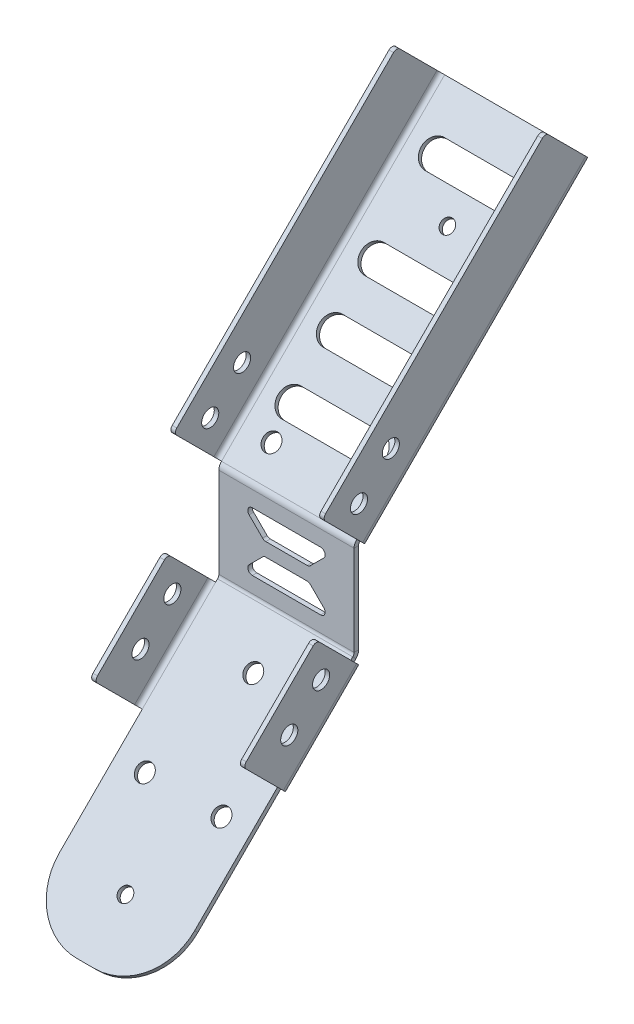
from build123d import *

# Parameters (mm, degrees)
BASE_FLANGE1_DEPTH     = 1
SKETCHED_START         = -30
SKETCHED_BEND5_DEPTH   = 60
SKETCHED_BEND5_2_DEPTH = 15
SKETCHED_START_2       = 15
SKETCHED_BEND5_3_DEPTH = 15
SKETCHED_BEND5_4_DEPTH = 60
SKETCHED_START_3       = -15
SKETCHED_BEND5_5_DEPTH = 30
SKETCHED_BEND6_DEPTH   = 60
SKETCHED_BEND6_2_DEPTH = 15
SKETCHED_BEND6_3_DEPTH = 15
SKETCHED_BEND6_4_DEPTH = 30
SKETCHED_BEND6_5_DEPTH = 60
SKETCHED_START_4       = -28.356310605
SKETCHED_BEND7_DEPTH   = 23
SKETCHED_BEND7_2_DEPTH = 23
SKETCHED_START_5       = 11.547743288
SKETCHED_BEND8_DEPTH   = 70
SKETCHED_BEND8_2_DEPTH = 70
CUT_EXTRUDE1_DEPTH     = 10
F_6_CLEARANCE_HOLE4_D  = 3.7973
F_6_CLEARANCE_HOLE2_D  = 3.7973
F_3_0MM_DOWEL_HOLE1_D  = 3
SKETCH47_R             = 1.525
CUT_EXTRUDE2_DEPTH     = 10
CUT_EXTRUDE3_DEPTH     = 10
FILLET2_R              = 13
FILLET1_R              = 1


# Read off the part's stored shape, not the designer's step: Sketched Bend5, Sketched Bend6, Sketched Bend7, Sketched Bend8
# Sheet-metal steps are written as plain solids
with BuildPart() as part:
    # Sketch1 → Base-Flange1 (new body)
    with BuildSketch(Plane.XY):
        Polygon((-30, -30.5), (-15, -30.5), (-15, -69.5), (15, -69.5), (15, -30.5), (30, -30.5), (30, -7.5), (15, -7.5), (15, 15.5), (30, 15.5), (30, 85.5), (-30, 85.5), (-30, 15.5), (-15, 15.5), (-15, -7.5), (-30, -7.5), align=None)
    extrude(amount=-BASE_FLANGE1_DEPTH)

    # Sketched Bend5 outline → Sketched Bend5 (cut)
    with BuildSketch(Plane.YZ.offset(SKETCHED_START)):
        with BuildLine():
            Line((15.714213562, -0.585786438), (16.128427124, -1))
            Line((16.128427124, -1), (85.5, -1))
            Line((85.5, -1), (85.5, 0))
            Line((85.5, 0), (14.3, 0))
            ThreePointArc((14.3, 0), (15.065366865, -0.152240935), (15.714213562, -0.585786438))
        make_face()
    extrude(amount=SKETCHED_BEND5_DEPTH, mode=Mode.SUBTRACT)

    # Sketched Bend5 2 outline → Sketched Bend5 2 (cut)
    with BuildSketch(Plane.YZ.offset(SKETCHED_START)):
        with BuildLine():
            Line((15.729701149, -0.601274024), (15.714213562, -0.585786438))
            ThreePointArc((15.714213562, -0.585786438), (15.610403483, -0.48909209), (15.5, -0.4))
            Line((15.5, -0.4), (15.5, -0.830975173))
            Line((15.5, -0.830975173), (15.729701149, -0.601274024))
        make_face()
    extrude(amount=SKETCHED_BEND5_2_DEPTH, mode=Mode.SUBTRACT)

    # Sketched Bend5 3 outline → Sketched Bend5 3 (cut)
    with BuildSketch(Plane.YZ.offset(SKETCHED_START_2)):
        with BuildLine():
            Line((15.729701149, -0.601274024), (15.714213562, -0.585786438))
            ThreePointArc((15.714213562, -0.585786438), (15.610403483, -0.48909209), (15.5, -0.4))
            Line((15.5, -0.4), (15.5, -0.830975173))
            Line((15.5, -0.830975173), (15.729701149, -0.601274024))
        make_face()
    extrude(amount=SKETCHED_BEND5_3_DEPTH, mode=Mode.SUBTRACT)

    # Sketched Bend5 4 outline → Sketched Bend5 4 (add)
    with BuildSketch(Plane.YZ.offset(SKETCHED_START)):
        Polygon((65.227175832, -50.098748707), (16.128427124, -1), (15.5, -1), (15.5, -0.830975173), (15.022594368, -1.308380805), (64.520069051, -50.805855488), align=None)
    extrude(amount=SKETCHED_BEND5_4_DEPTH)

    # Sketched Bend5 5 outline → Sketched Bend5 5 (add)
    with BuildSketch(Plane.YZ.offset(SKETCHED_START_3)):
        with BuildLine():
            Line((15.022594368, -1.308380805), (15.330975173, -1))
            Line((15.330975173, -1), (14.3, -1))
            ThreePointArc((14.3, -1), (14.682683432, -1.076120467), (15.007106781, -1.292893219))
            Line((15.007106781, -1.292893219), (15.022594368, -1.308380805))
        make_face()
    extrude(amount=SKETCHED_BEND5_5_DEPTH)

    # Sketched Bend6 outline → Sketched Bend6 (cut)
    with BuildSketch(Plane.YZ.offset(SKETCHED_START)):
        with BuildLine():
            ThreePointArc((-5.710951377, -1), (-6.476318242, -0.847759065), (-7.12516494, -0.414213562))
            Line((-7.12516494, -0.414213562), (-7.539378502, 0))
            Line((-7.539378502, 0), (-69.5, 0))
            Line((-69.5, 0), (-69.5, -1))
            Line((-69.5, -1), (-5.710951377, -1))
        make_face()
    extrude(amount=SKETCHED_BEND6_DEPTH, mode=Mode.SUBTRACT)

    # Sketched Bend6 2 outline → Sketched Bend6 2 (cut)
    with BuildSketch(Plane.YZ.offset(SKETCHED_START)):
        Polygon((-7.539378502, 0), (-7.5, -0.039378502), (-7.5, 0), align=None)
    extrude(amount=SKETCHED_BEND6_2_DEPTH, mode=Mode.SUBTRACT)

    # Sketched Bend6 3 outline → Sketched Bend6 3 (cut)
    with BuildSketch(Plane.YZ.offset(SKETCHED_START_2)):
        Polygon((-7.539378502, 0), (-7.5, -0.039378502), (-7.5, 0), align=None)
    extrude(amount=SKETCHED_BEND6_3_DEPTH, mode=Mode.SUBTRACT)

    # Sketched Bend6 4 outline → Sketched Bend6 4 (add)
    with BuildSketch(Plane.YZ.offset(SKETCHED_START_3)):
        with BuildLine():
            Line((-7.539378502, 0), (-5.710951377, 0))
            ThreePointArc((-5.710951377, 0), (-6.09363481, 0.076120467), (-6.418058159, 0.292893219))
            Line((-6.418058159, 0.292893219), (-50.690686454, 44.565521514))
            Line((-50.690686454, 44.565521514), (-51.397793235, 43.858414733))
            Line((-51.397793235, 43.858414733), (-7.539378502, 0))
        make_face()
    extrude(amount=SKETCHED_BEND6_4_DEPTH)

    # Sketched Bend6 5 outline → Sketched Bend6 5 (add)
    with BuildSketch(Plane.YZ.offset(SKETCHED_START)):
        Polygon((-23.820628769, 16.281250267), (-7.557172802, 0.0177943), (-6.850066021, 0.724901081), (-23.113521988, 16.988357048), align=None)
    extrude(amount=SKETCHED_BEND6_5_DEPTH)

    # Sketched Bend7 outline → Sketched Bend7 (cut)
    with BuildSketch(Plane(origin=(0, 0, 0), x_dir=(1, 0, 0), z_dir=(0, 0.707106781186546, -0.707106781186549)).offset(SKETCHED_START_4)):
        with BuildLine():
            ThreePointArc((-16.732050807, 4.331145665), (-16, 5.063196472), (-15, 5.331145665))
            Line((-15, 5.331145665), (-30, 5.331145665))
            Line((-30, 5.331145665), (-30, 4.331145665))
            Line((-30, 4.331145665), (-16.732050807, 4.331145665))
        make_face()
        with BuildLine():
            Line((30, 5.331145665), (15, 5.331145665))
            ThreePointArc((15, 5.331145665), (16, 5.063196472), (16.732050807, 4.331145665))
            Line((16.732050807, 4.331145665), (30, 4.331145665))
            Line((30, 4.331145665), (30, 5.331145665))
        make_face()
    extrude(amount=SKETCHED_BEND7_DEPTH, mode=Mode.SUBTRACT)

    # Sketched Bend7 2 outline → Sketched Bend7 2 (add)
    with BuildSketch(Plane(origin=(0, 0, 0), x_dir=(1, 0, 0), z_dir=(0, 0.707106781186546, -0.707106781186549)).offset(SKETCHED_START_4)):
        with BuildLine():
            Line((-15, 4.331145665), (-16.732050807, 4.331145665))
            ThreePointArc((-16.732050807, 4.331145665), (-16.931851652, 3.848783755), (-17, 3.331145665))
            Line((-17, 3.331145665), (-17, -9.312659845))
            Line((-17, -9.312659845), (-16, -9.312659845))
            Line((-16, -9.312659845), (-16, 3.331145665))
            ThreePointArc((-16, 3.331145665), (-15.707106781, 4.038252446), (-15, 4.331145665))
        make_face()
        with BuildLine():
            ThreePointArc((17, 3.331145665), (16.931851652, 3.848783755), (16.732050807, 4.331145665))
            Line((16.732050807, 4.331145665), (15, 4.331145665))
            ThreePointArc((15, 4.331145665), (15.707106781, 4.038252446), (16, 3.331145665))
            Line((16, 3.331145665), (16, -9.312659845))
            Line((16, -9.312659845), (17, -9.312659845))
            Line((17, -9.312659845), (17, 3.331145665))
        make_face()
    extrude(amount=SKETCHED_BEND7_2_DEPTH)

    # Sketched Bend8 outline → Sketched Bend8 (cut)
    with BuildSketch(Plane(origin=(0, 0, 0), x_dir=(1, 0, 0), z_dir=(0, 0.707106781186546, -0.707106781186549)).offset(SKETCHED_START_5)):
        with BuildLine():
            Line((-30, -10.697413409), (-16.732050808, -10.697413409))
            ThreePointArc((-16.732050808, -10.697413409), (-16, -9.965362601), (-15, -9.697413409))
            Line((-15, -9.697413409), (-30, -9.697413409))
            Line((-30, -9.697413409), (-30, -10.697413409))
        make_face()
        with BuildLine():
            Line((30, -9.697413409), (15, -9.697413409))
            ThreePointArc((15, -9.697413409), (16, -9.965362601), (16.732050808, -10.697413409))
            Line((16.732050808, -10.697413409), (30, -10.697413409))
            Line((30, -10.697413409), (30, -9.697413409))
        make_face()
    extrude(amount=SKETCHED_BEND8_DEPTH, mode=Mode.SUBTRACT)

    # Sketched Bend8 2 outline → Sketched Bend8 2 (add)
    with BuildSketch(Plane(origin=(0, 0, 0), x_dir=(1, 0, 0), z_dir=(0, 0.707106781186546, -0.707106781186549)).offset(SKETCHED_START_5)):
        with BuildLine():
            ThreePointArc((-16.732050808, -10.697413409), (-16.931851653, -11.179775319), (-17, -11.697413409))
            Line((-17, -11.697413409), (-17, -24.341218918))
            Line((-17, -24.341218918), (-16, -24.341218918))
            Line((-16, -24.341218918), (-16, -11.697413409))
            ThreePointArc((-16, -11.697413409), (-15.707106781, -10.990306628), (-15, -10.697413409))
            Line((-15, -10.697413409), (-16.732050808, -10.697413409))
        make_face()
        with BuildLine():
            Line((16.732050808, -10.697413409), (15, -10.697413409))
            ThreePointArc((15, -10.697413409), (15.707106781, -10.990306628), (16, -11.697413409))
            Line((16, -11.697413409), (16, -24.341218918))
            Line((16, -24.341218918), (17, -24.341218918))
            Line((17, -24.341218918), (17, -11.697413409))
            ThreePointArc((17, -11.697413409), (16.931851653, -11.179775319), (16.732050808, -10.697413409))
        make_face()
    extrude(amount=SKETCHED_BEND8_2_DEPTH)

    # Sketch36 → Cut-Extrude1 (cut)
    with BuildSketch(Plane(origin=(0, 7.564213562, 7.564213562), x_dir=(1, 0, 0), z_dir=(0, 0.7071067811865487, 0.7071067811865465))):
        with BuildLine():
            Line((-9, 28), (9, 28))
            ThreePointArc((9, 28), (12, 25), (9, 22))
            Line((9, 22), (-9, 22))
            ThreePointArc((-9, 22), (-12, 25), (-9, 28))
        make_face()
        with BuildLine():
            Line((-9, 41), (9, 41))
            ThreePointArc((9, 41), (12, 38), (9, 35))
            Line((9, 35), (-9, 35))
            ThreePointArc((-9, 35), (-12, 38), (-9, 41))
        make_face()
        with BuildLine():
            Line((-9, 54), (9, 54))
            ThreePointArc((9, 54), (12, 51), (9, 48))
            Line((9, 48), (-9, 48))
            ThreePointArc((-9, 48), (-12, 51), (-9, 54))
        make_face()
        with BuildLine():
            Line((-9, 73), (9, 73))
            ThreePointArc((9, 73), (12, 70), (9, 67))
            Line((9, 67), (-9, 67))
            ThreePointArc((-9, 67), (-12, 70), (-9, 73))
        make_face()
    extrude(amount=-CUT_EXTRUDE1_DEPTH, mode=Mode.SUBTRACT)

    # #6 Clearance Hole4 (through all)
    with Locations(Plane(origin=(0, 7.564213562, 7.564213562), x_dir=(1, 0, 0), z_dir=(0, 0.7071067811865487, 0.7071067811865465))):
        with Locations((-8.5, 18.025840533), (8.5, 18.025840533), (0, -14.745359227), (-8.5, -36.745359227), (8.5, -36.745359227)):
            Hole(F_6_CLEARANCE_HOLE4_D / 2)

    # #6 Clearance Hole2 (through all)
    with Locations(Plane(origin=(17, 0, 0), x_dir=(0, 0, -1), z_dir=(1, 0, 0))):
        with Locations((-9.311868306, -5.334166607), (-16.382936118, -12.405234419), (-0.914625389, 24.316668374), (6.156442422, 31.387736186)):
            Hole(F_6_CLEARANCE_HOLE2_D / 2)

    # Ø3.0mm Dowel Hole1 (through all)
    with Locations(Plane(origin=(0, 7.564213562, 7.564213562), x_dir=(1, 0, 0), z_dir=(0, 0.7071067811865487, 0.7071067811865465))):
        with Locations((0, 61.187743288)):
            Hole(F_3_0MM_DOWEL_HOLE1_D / 2)

    # Sketch47 → Cut-Extrude2 (cut)
    with BuildSketch(Plane(origin=(0, -3.06258247, -3.06258247), x_dir=(1, 0, 0), z_dir=(0, 0.7071067811865487, 0.7071067811865465))):
        with Locations(Location((0, -54.856310605, 0), (0, 0, 270))):
            Circle(SKETCH47_R)
    extrude(amount=-CUT_EXTRUDE2_DEPTH, mode=Mode.SUBTRACT)

    # Sketch48 → Cut-Extrude3 (cut)
    with BuildSketch(Plane.XY):
        Polygon((-10, 10.8), (10, 10.8), (5, 5.8), (-5, 5.8), align=None)
        Polygon((-10, -2.210951377), (-5, 2.789048623), (5, 2.789048623), (10, -2.210951377), align=None)
    extrude(amount=-CUT_EXTRUDE3_DEPTH, mode=Mode.SUBTRACT)

    # Fillet2
    fillet2_edges = [part.edges().sort_by_distance(p)[0] for p in [
        (-15, -51.044239844, 44.211968124),
        (15, -51.044239844, 44.211968124),
    ]]
    fillet(fillet2_edges, radius=FILLET2_R)

    # Fillet1
    fillet1_edges = [part.edges().sort_by_distance(p)[0] for p in [
        (-16.5, -13.465894591, 26.635984446),
        (-16.5, 2.797561376, 10.372528478),
        (16.5, 2.797561376, 10.372528478),
        (16.5, -13.465894591, 26.635984446),
        (-16.5, 25.377328546, 9.046353373),
        (-16.5, 74.874803229, -40.45112131),
        (16.5, 74.874803229, -40.45112131),
        (16.5, 25.377328546, 9.046353373),
        (-5, 5.8, -0.5),
        (-10, 10.8, -0.5),
        (10, 10.8, -0.5),
        (5, 5.8, -0.5),
        (10, -2.210951377, -0.5),
        (-10, -2.210951377, -0.5),
        (-5, 2.789048623, -0.5),
        (5, 2.789048623, -0.5),
    ]]
    fillet(fillet1_edges, radius=FILLET1_R)


solid = part.part
